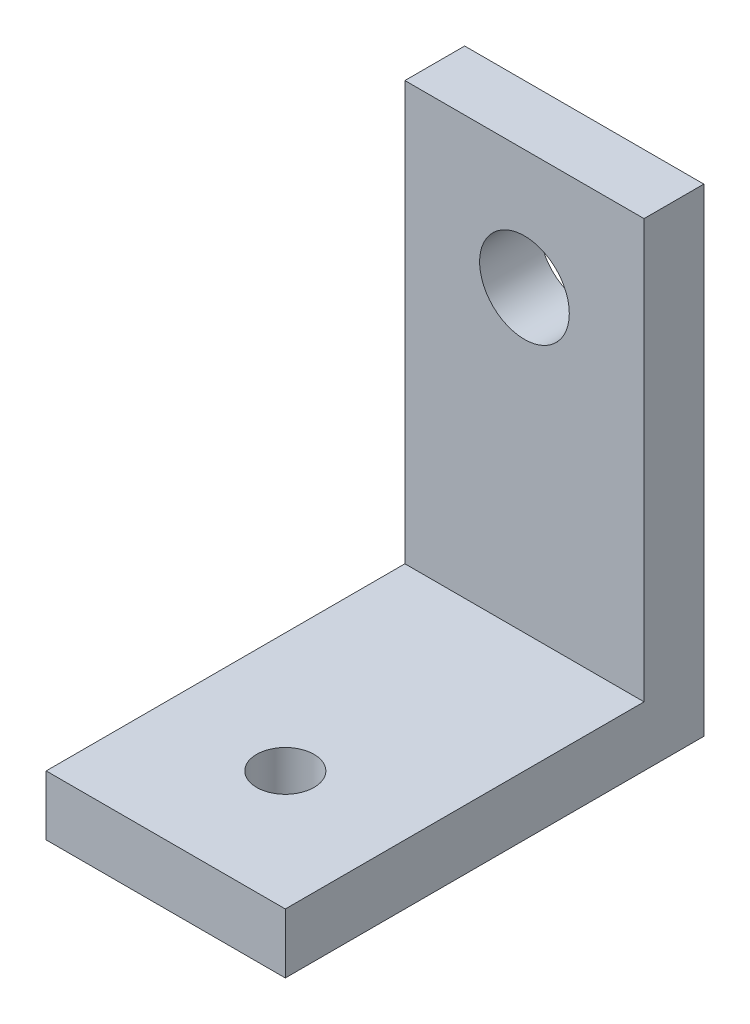
from build123d import *

# Parameters (mm, degrees)
SKETCH1_R           = 2.38125
BOSS_EXTRUDE1_DEPTH = 3.175
SKETCH2_W           = 12.7
SKETCH2_H           = 3.175
BOSS_EXTRUDE2_DEPTH = 19.05
SKETCH3_R           = 1.524
CUT_EXTRUDE1_DEPTH  = 19.05


with BuildPart() as part:
    # Sketch1 → Boss-Extrude1 (new body)
    with BuildSketch(Plane.XY):
        Polygon((-6.35, 0), (-6.35, -19.05), (6.35, -19.05), (6.35, 0), (6.35, 6.35), (-6.35, 6.35), align=None)
        Circle(SKETCH1_R, mode=Mode.SUBTRACT)
    extrude(amount=BOSS_EXTRUDE1_DEPTH)

    # Sketch2 → Boss-Extrude2 (add)
    with BuildSketch(Plane.XY.offset(3.175)):
        with Locations((0, -17.4625)):
            Rectangle(SKETCH2_W, SKETCH2_H)
    extrude(amount=BOSS_EXTRUDE2_DEPTH)

    # Sketch3 → Cut-Extrude1 (cut)
    with BuildSketch(Plane(origin=(0, -15.875, 0), x_dir=(1, 0, 0), z_dir=(0, 1, 0))):
        with Locations((0, -15.875)):
            Circle(SKETCH3_R)
    extrude(amount=-CUT_EXTRUDE1_DEPTH, mode=Mode.SUBTRACT)


solid = part.part
